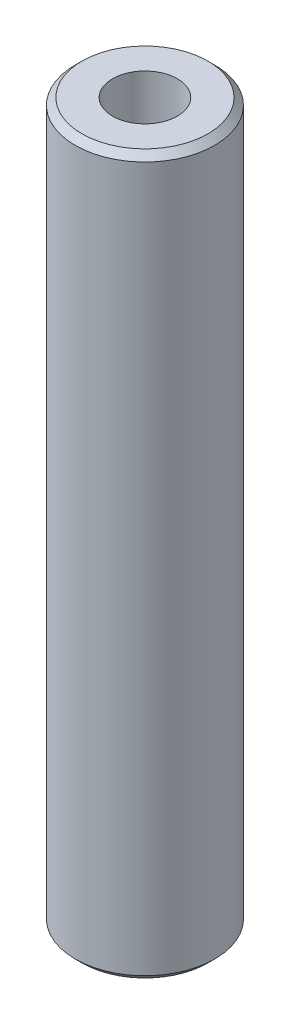
from build123d import *

# Parameters (mm, degrees)
SKETCH1_R           = 57.5
BOSS_EXTRUDE1_DEPTH = 592.414431145
SKETCH2_R           = 26.737565174
CUT_EXTRUDE1_DEPTH  = 598.969362283
CHAMFER1_SIZE       = 5.513728136


with BuildPart() as part:
    # Sketch1 → Boss-Extrude1 (new body)
    with BuildSketch(Plane(origin=(0, 0, 0), x_dir=(1, 0, 0), z_dir=(0, 1, 0))):
        Circle(SKETCH1_R)
    extrude(amount=BOSS_EXTRUDE1_DEPTH)

    # Sketch2 → Cut-Extrude1 (cut, through all)
    with BuildSketch(Plane(origin=(0, 0, 0), x_dir=(1, 0, 0), z_dir=(0, 1, 0))):
        Circle(SKETCH2_R)
    extrude(amount=CUT_EXTRUDE1_DEPTH, mode=Mode.SUBTRACT)

    # Chamfer1
    chamfer1_edges = [part.edges().sort_by_distance(p)[0] for p in [
        (-57.5, 592.414431145, 0),
        (-57.5, 0, 0),
    ]]
    chamfer(chamfer1_edges, length=CHAMFER1_SIZE)


solid = part.part
